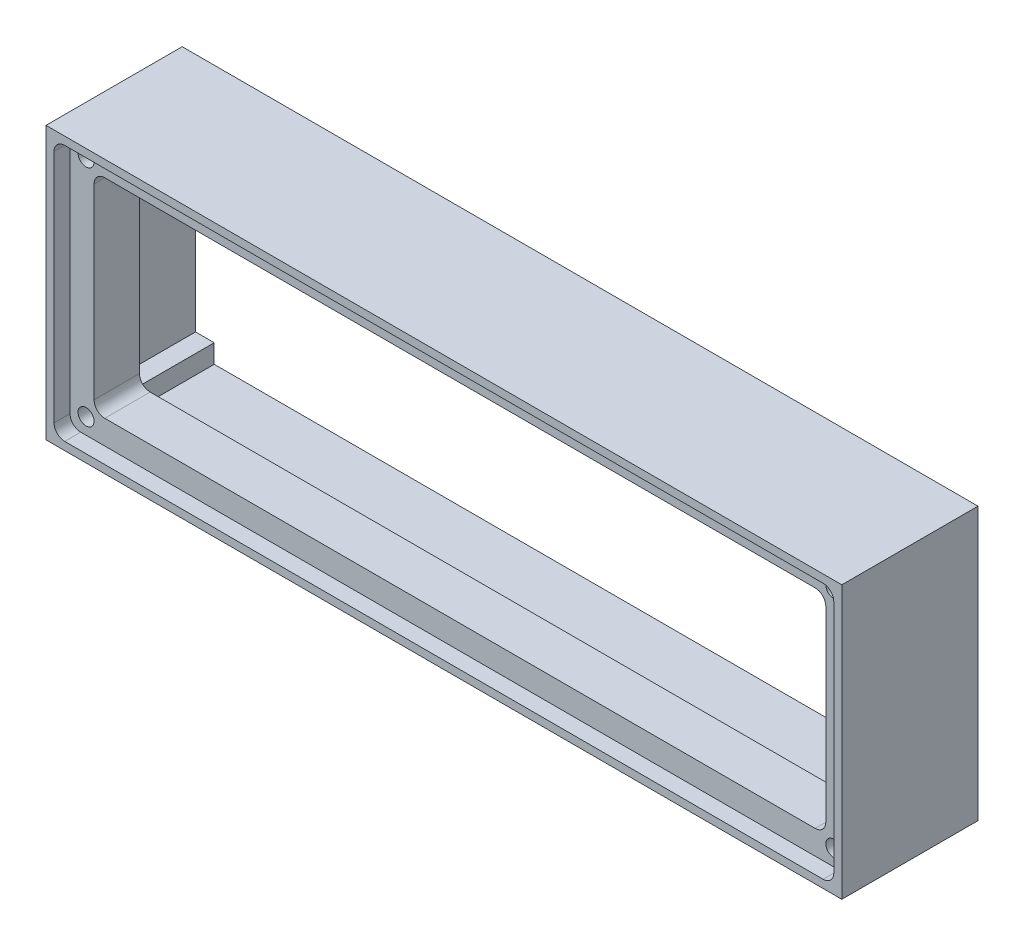
from build123d import *

# Parameters (mm, degrees)
SKETCH1_W           = 149
SKETCH1_H           = 51
SKETCH1_W_2         = 137
SKETCH1_H_2         = 39
EXTRUDE_THIN1_DEPTH = 25.5
SKETCH2_W           = 146
SKETCH2_H           = 48
CUT_EXTRUDE1_DEPTH  = 3
SKETCH3_R           = 1.5
CUT_EXTRUDE2_DEPTH  = 8
SKETCH4_R           = 1.5
CUT_EXTRUDE3_DEPTH  = 8
FILLET1_R           = 2
FILLET2_R           = 2
CUT_EXTRUDE7_DEPTH  = 14


with BuildPart() as part:
    # Sketch1 → Extrude-Thin1 (new body)
    with BuildSketch(Plane.XY):
        with Locations((74.5, 25.5)):
            Rectangle(SKETCH1_W, SKETCH1_H)
        with Locations((74.5, 25.5)):
            Rectangle(SKETCH1_W_2, SKETCH1_H_2, mode=Mode.SUBTRACT)
    extrude(amount=EXTRUDE_THIN1_DEPTH)

    # Sketch2 → Cut-Extrude1 (cut)
    with BuildSketch(Plane.XY.offset(25.5)):
        with Locations((74.5, 25.5)):
            Rectangle(SKETCH2_W, SKETCH2_H)
    extrude(amount=-CUT_EXTRUDE1_DEPTH, mode=Mode.SUBTRACT)

    # Sketch3 → Cut-Extrude2 (cut)
    with BuildSketch(Plane.XY.offset(22.5)):
        with Locations((4.5, 46.5)):
            Circle(SKETCH3_R)
        with Locations((144.5, 46.5)):
            Circle(SKETCH3_R)
        with Locations((4.5, 4.5)):
            Circle(SKETCH3_R)
        with Locations((144.5, 4.5)):
            Circle(SKETCH3_R)
    extrude(amount=-CUT_EXTRUDE2_DEPTH, mode=Mode.SUBTRACT)

    # Sketch4 → Cut-Extrude3 (cut)
    with BuildSketch(Plane(origin=(0, 0, 0), x_dir=(-1, 0, 0), z_dir=(0, 0, -1))):
        with Locations((-3, 3)):
            Circle(SKETCH4_R)
        with Locations((-3, 48)):
            Circle(SKETCH4_R)
        with Locations((-146, 3)):
            Circle(SKETCH4_R)
        with Locations((-146, 48)):
            Circle(SKETCH4_R)
    extrude(amount=-CUT_EXTRUDE3_DEPTH, mode=Mode.SUBTRACT)

    # Fillet1
    fillet1_edges = [part.edges().sort_by_distance(p)[0] for p in [
        (147.5, 1.5, 24),
        (147.5, 49.5, 24),
        (1.5, 49.5, 24),
        (1.5, 1.5, 24),
    ]]
    fillet(fillet1_edges, radius=FILLET1_R)

    # Fillet2
    fillet2_edges = [part.edges().sort_by_distance(p)[0] for p in [
        (143, 45, 11.25),
        (143, 6, 11.25),
        (6, 6, 11.25),
        (6, 45, 11.25),
    ]]
    fillet(fillet2_edges, radius=FILLET2_R)

    # Sketch6 → Cut-Extrude7 (cut)
    with BuildSketch(Plane(origin=(0, 0, 0), x_dir=(-1, 0, 0), z_dir=(0, 0, -1))):
        Polygon((-143, 45), (-146.5, 45), (-146.5, 6), (-143, 6), (-143, 2.5), (-6, 2.5), (-6, 6), (-2.5, 6), (-2.5, 45), (-6, 45), (-6, 48.5), (-143, 48.5), align=None)
    extrude(amount=-CUT_EXTRUDE7_DEPTH, mode=Mode.SUBTRACT)


solid = part.part
